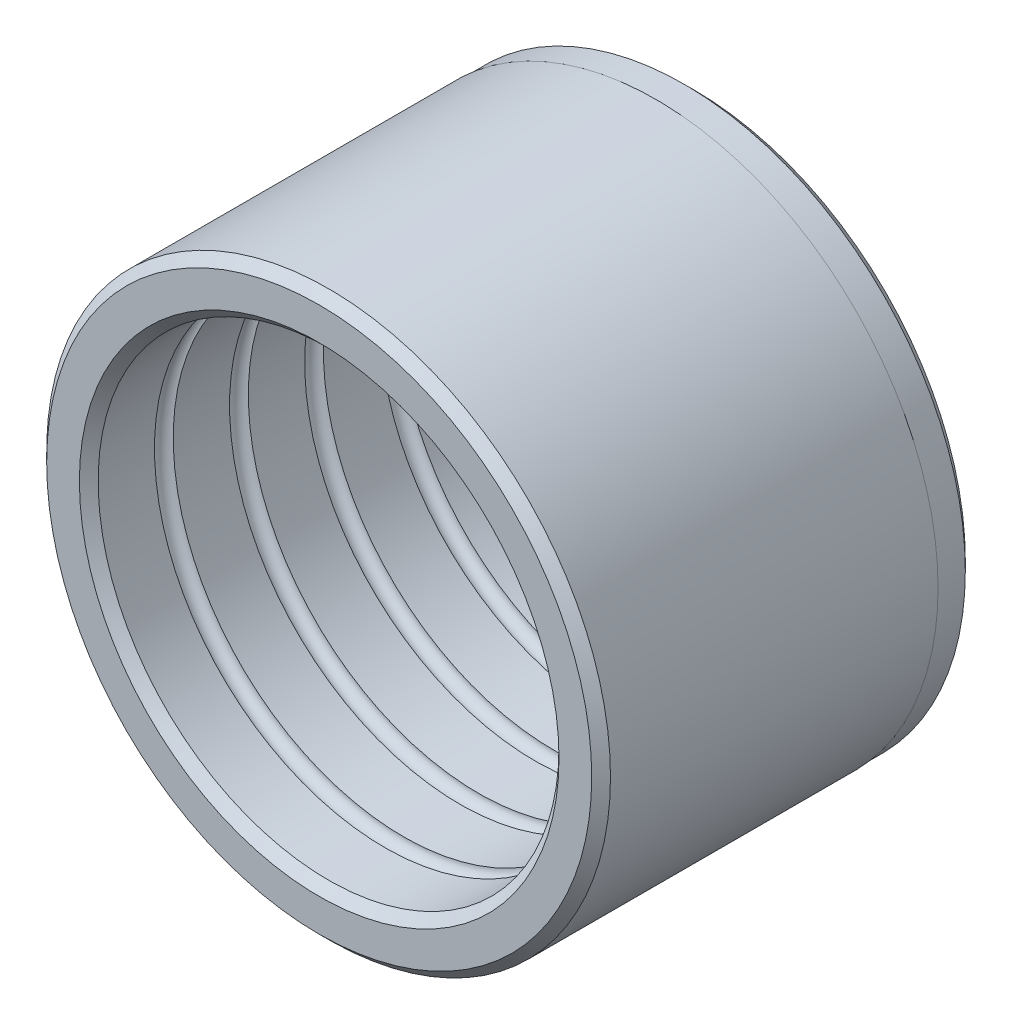
from build123d import *


with BuildPart() as part:
    # Sketch1 → Revolve1 (revolve)
    with BuildSketch(Plane(origin=(0, 0, 0), x_dir=(0, 0, -1), z_dir=(1, 0, 0))):
        with BuildLine():
            Line((0.5, 15.0175), (17.95, 15.0175))
            Line((17.95, 15.0175), (17.95, 14.97))
            Line((17.95, 14.97), (19.45, 14.97))
            Line((19.45, 14.97), (19.95, 14.47))
            Line((19.95, 14.47), (19.95, 12.775))
            Line((19.95, 12.775), (19.45, 12.275))
            Line((19.45, 12.275), (16.5, 12.275))
            ThreePointArc((16.5, 12.275), (16, 12.775), (15.5, 12.275))
            Line((15.5, 12.275), (12.5, 12.275))
            ThreePointArc((12.5, 12.275), (12, 12.775), (11.5, 12.275))
            Line((11.5, 12.275), (8.5, 12.275))
            ThreePointArc((8.5, 12.275), (8, 12.775), (7.5, 12.275))
            Line((7.5, 12.275), (4.5, 12.275))
            ThreePointArc((4.5, 12.275), (4, 12.775), (3.5, 12.275))
            Line((3.5, 12.275), (0.5, 12.275))
            Line((0.5, 12.275), (0, 12.775))
            Line((0, 12.775), (0, 14.5175))
            Line((0, 14.5175), (0.5, 15.0175))
        make_face()
    revolve(axis=Axis((0, 0, 0), (0, 0, -1)))


solid = part.part
